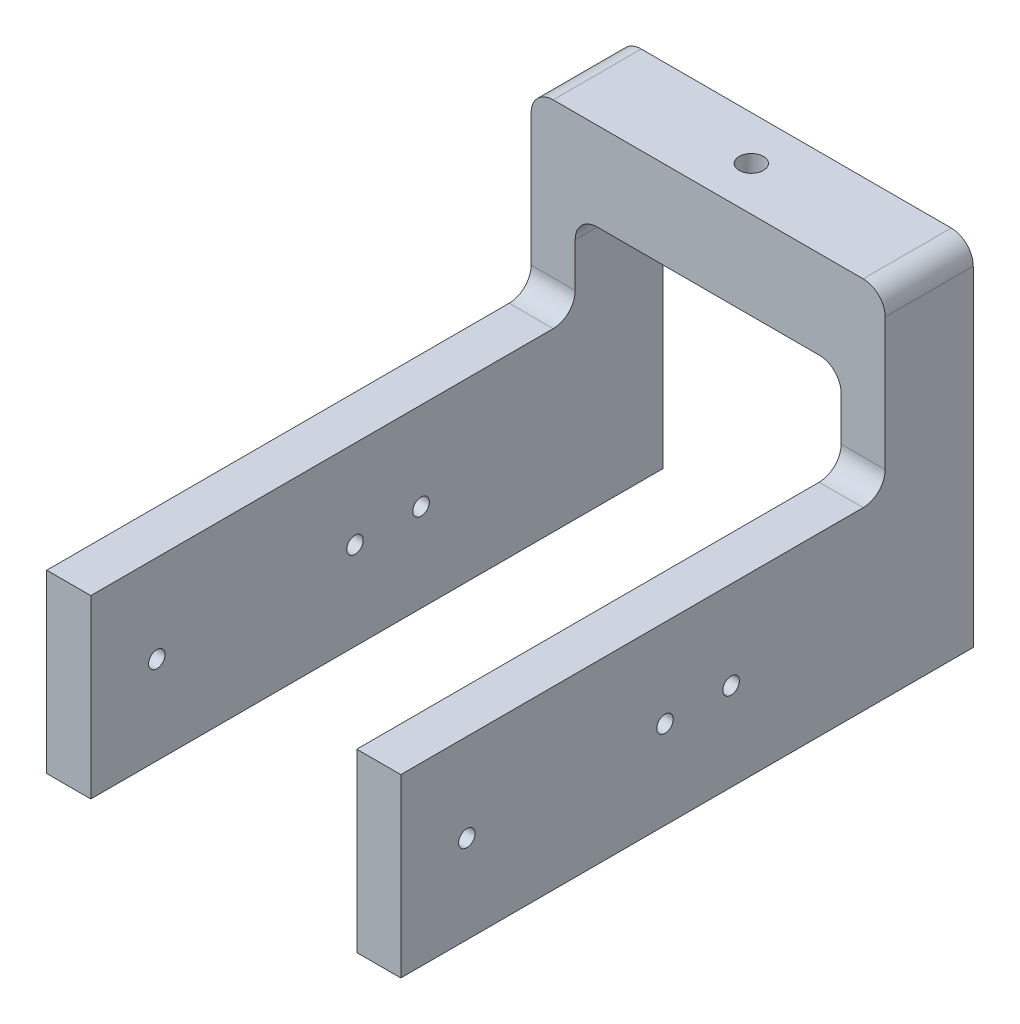
from build123d import *

# Parameters (mm, degrees)
BOSS_EXTRUDE1_DEPTH   = 102.108
SKETCH2_W             = 76.708
SKETCH2_H             = 76.2
CUT_EXTRUDE1_DEPTH    = 220.104116036
F_7_0MM_DOWEL_HOLE1_D = 7
FILLET1_R             = 6.35
SKETCH5_R             = 2.38125
CUT_EXTRUDE2_DEPTH    = 220.104116036


with BuildPart() as part:
    # Sketch1 → Boss-Extrude1 (new body)
    with BuildSketch(Plane(origin=(0, 0, 0), x_dir=(0, 0, -1), z_dir=(1, 0, 0))):
        Polygon((0, 0), (-165.1, 0), (-165.1, 50.8), (-25.4, 50.8), (-25.4, 101.6), (0, 101.6), align=None)
    extrude(amount=BOSS_EXTRUDE1_DEPTH)

    # Sketch2 → Cut-Extrude1 (cut, through all)
    with BuildSketch(Plane(origin=(0, 0, 0), x_dir=(-1, 0, 0), z_dir=(0, 0, -1))):
        with Locations((-51.054, 38.1)):
            Rectangle(SKETCH2_W, SKETCH2_H)
    extrude(amount=-CUT_EXTRUDE1_DEPTH, mode=Mode.SUBTRACT)

    # Ø7.0mm Dowel Hole1 (through all)
    with Locations(Plane(origin=(0, 101.6, 0), x_dir=(1, 0, 0), z_dir=(0, 1, 0))):
        with Locations((50.8, -12.7)):
            Hole(F_7_0MM_DOWEL_HOLE1_D / 2)

    # Fillet1
    fillet1_edges = [part.edges().sort_by_distance(p)[0] for p in [
        (89.408, 76.2, 12.7),
        (12.7, 76.2, 12.7),
        (6.35, 50.8, 25.4),
        (95.758, 50.8, 25.4),
        (102.108, 101.6, 12.7),
        (0, 101.6, 12.7),
    ]]
    fillet(fillet1_edges, radius=FILLET1_R)

    # Sketch5 → Cut-Extrude2 (cut, through all)
    with BuildSketch(Plane(origin=(102.108, 0, 0), x_dir=(0, 0, -1), z_dir=(1, 0, 0))):
        with Locations((-146.05, 25.4)):
            Circle(SKETCH5_R)
        with Locations((-88.9, 25.4)):
            Circle(SKETCH5_R)
        with Locations((-69.85, 25.4)):
            Circle(SKETCH5_R)
    extrude(amount=-CUT_EXTRUDE2_DEPTH, mode=Mode.SUBTRACT)


solid = part.part
